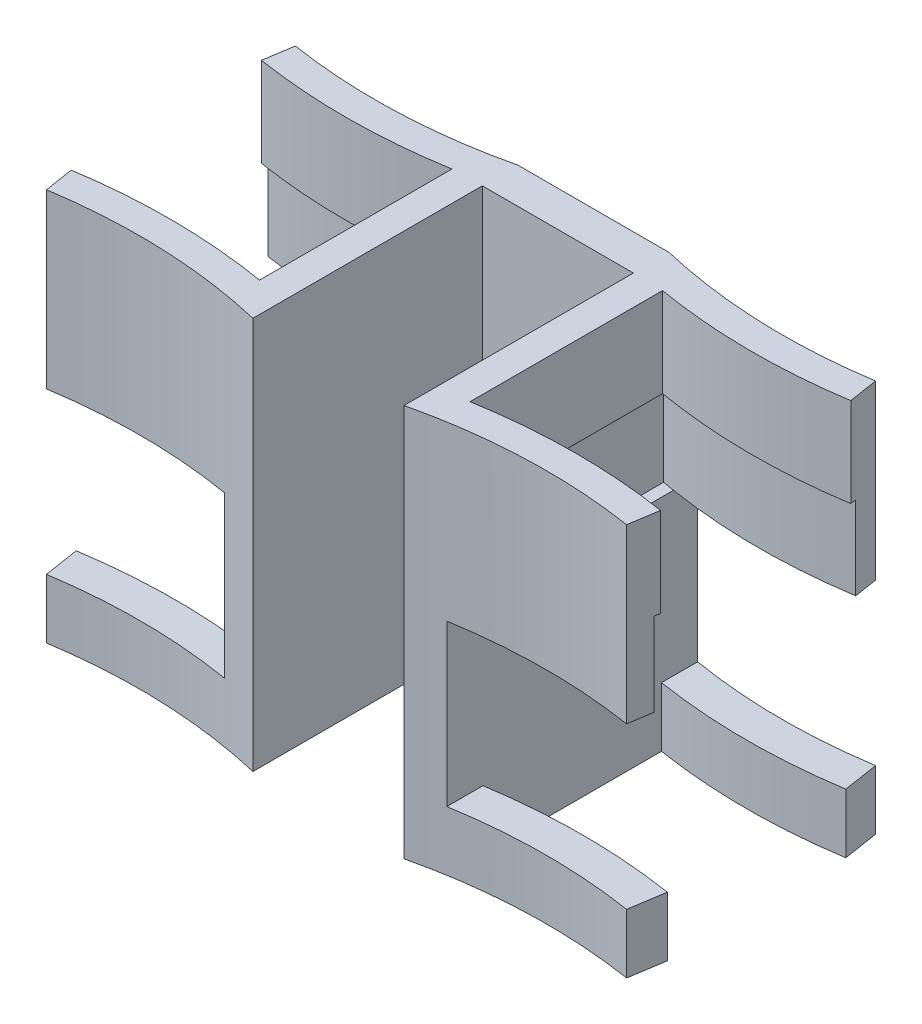
from build123d import *

# Parameters (mm, degrees)
BOSS_EXTRUDE1_DEPTH = 66
CUT_EXTRUDE1_START  = -15
CUT_EXTRUDE1_DEPTH  = 15
CUT_EXTRUDE2_START  = -14
CUT_EXTRUDE2_DEPTH  = 14
SKETCH4_W           = 44.566501288
SKETCH4_H           = 27
CUT_EXTRUDE3_DEPTH  = 103.576483765
SKETCH5_W           = 44.566501288
SKETCH5_H           = 27
CUT_EXTRUDE4_DEPTH  = 103.576483765


with BuildPart() as part:
    # Sketch1 → Boss-Extrude1 (new body)
    with BuildSketch(Plane(origin=(0, 0, 0), x_dir=(1, 0, 0), z_dir=(0, 1, 0))):
        with BuildLine():
            Line((-6, -1.283250644), (-6, -31.283250644))
            ThreePointArc((-6, -31.283250644), (-21.5, -30.074697642), (-37, -31.283250644))
            Line((-37, -31.283250644), (-36.07, -37.210737464))
            ThreePointArc((-36.07, -37.210737464), (-17.969313256, -36.14102822), (0, -38.566501288))
            Line((0, -38.566501288), (0, 0))
            Line((0, 0), (25.4, 0))
            Line((25.4, 0), (25.4, -38.566501288))
            ThreePointArc((25.4, -38.566501288), (43.369313256, -36.14102822), (61.47, -37.210737464))
            Line((61.47, -37.210737464), (62.4, -31.283250644))
            ThreePointArc((62.4, -31.283250644), (46.9, -30.074697642), (31.4, -31.283250644))
            Line((31.4, -31.283250644), (31.4, -1.283250644))
            ThreePointArc((31.4, -1.283250644), (46.9, -2.491803646), (62.4, -1.283250644))
            Line((62.4, -1.283250644), (61.47, 4.644236176))
            ThreePointArc((61.47, 4.644236176), (43.369313256, 3.574526932), (25.4, 6))
            Line((25.4, 6), (0, 6))
            ThreePointArc((0, 6), (-17.969313256, 3.574526932), (-36.07, 4.644236176))
            Line((-36.07, 4.644236176), (-37, -1.283250644))
            ThreePointArc((-37, -1.283250644), (-21.5, -2.491803646), (-6, -1.283250644))
        make_face()
    extrude(amount=BOSS_EXTRUDE1_DEPTH)

    # Sketch2 → Cut-Extrude1 (cut)
    # profile 1 of 2: a face of its own
    with BuildSketch(Plane(origin=(0, 66, 0), x_dir=(1, 0, 0), z_dir=(0, 1, 0)).offset(CUT_EXTRUDE1_START)):
        with BuildLine():
            Line((-5, -0.107120067), (-5, -32.459381221))
            ThreePointArc((-5, -32.459381221), (-21.5, -31.074697642), (-38, -32.459381221))
            Line((-38, -32.459381221), (-38, -0.107120067))
            ThreePointArc((-38, -0.107120067), (-21.5, -1.491803646), (-5, -0.107120067))
        make_face()
        with BuildLine():
            Line((-6, -1.283250644), (-6, -31.283250644))
            ThreePointArc((-6, -31.283250644), (-21.5, -30.074697642), (-37, -31.283250644))
            Line((-37, -31.283250644), (-37, -1.283250644))
            ThreePointArc((-37, -1.283250644), (-21.5, -2.491803646), (-6, -1.283250644))
        make_face(mode=Mode.SUBTRACT)
    # profile 2 of 2: a face of its own
    with BuildSketch(Plane(origin=(0, 66, 0), x_dir=(1, 0, 0), z_dir=(0, 1, 0)).offset(CUT_EXTRUDE1_START)):
        with BuildLine():
            Line((63.4, -0.107120067), (63.4, -32.459381221))
            ThreePointArc((63.4, -32.459381221), (46.9, -31.074697642), (30.4, -32.459381221))
            Line((30.4, -32.459381221), (30.4, -0.107120067))
            ThreePointArc((30.4, -0.107120067), (46.9, -1.491803646), (63.4, -0.107120067))
        make_face()
        with BuildLine():
            Line((31.4, -1.283250644), (31.4, -31.283250644))
            ThreePointArc((31.4, -31.283250644), (46.9, -30.074697642), (62.4, -31.283250644))
            Line((62.4, -31.283250644), (62.4, -1.283250644))
            ThreePointArc((62.4, -1.283250644), (46.9, -2.491803646), (31.4, -1.283250644))
        make_face(mode=Mode.SUBTRACT)
    extrude(amount=CUT_EXTRUDE1_DEPTH, mode=Mode.SUBTRACT)

    # Sketch3 → Cut-Extrude2 (cut)
    # profile 1 of 2: a face of its own
    with BuildSketch(Plane(origin=(0, 51, 0), x_dir=(1, 0, 0), z_dir=(0, 1, 0)).offset(CUT_EXTRUDE2_START)):
        with BuildLine():
            Line((-4, 1.083355157), (-4, -33.649856445))
            ThreePointArc((-4, -33.649856445), (-21.5, -32.074697642), (-39, -33.649856445))
            Line((-39, -33.649856445), (-39, 1.083355157))
            ThreePointArc((-39, 1.083355157), (-21.5, -0.491803646), (-4, 1.083355157))
        make_face()
        with BuildLine():
            Line((-37, -1.283250644), (-37, -31.283250644))
            ThreePointArc((-37, -31.283250644), (-21.5, -30.074697642), (-6, -31.283250644))
            Line((-6, -31.283250644), (-6, -1.283250644))
            ThreePointArc((-6, -1.283250644), (-21.5, -2.491803646), (-37, -1.283250644))
        make_face(mode=Mode.SUBTRACT)
    # profile 2 of 2: a face of its own
    with BuildSketch(Plane(origin=(0, 51, 0), x_dir=(1, 0, 0), z_dir=(0, 1, 0)).offset(CUT_EXTRUDE2_START)):
        with BuildLine():
            Line((64.4, 1.083355157), (64.4, -33.649856445))
            ThreePointArc((64.4, -33.649856445), (46.9, -32.074697642), (29.4, -33.649856445))
            Line((29.4, -33.649856445), (29.4, 1.083355157))
            ThreePointArc((29.4, 1.083355157), (46.9, -0.491803646), (64.4, 1.083355157))
        make_face()
        with BuildLine():
            Line((31.4, -1.283250644), (31.4, -31.283250644))
            ThreePointArc((31.4, -31.283250644), (46.9, -30.074697642), (62.4, -31.283250644))
            Line((62.4, -31.283250644), (62.4, -1.283250644))
            ThreePointArc((62.4, -1.283250644), (46.9, -2.491803646), (31.4, -1.283250644))
        make_face(mode=Mode.SUBTRACT)
    extrude(amount=CUT_EXTRUDE2_DEPTH, mode=Mode.SUBTRACT)

    # Sketch4 → Cut-Extrude3 (cut, through all)
    with BuildSketch(Plane.ZY.offset(6)):
        with Locations((16.283250644, 23.5)):
            Rectangle(SKETCH4_W, SKETCH4_H)
    extrude(amount=CUT_EXTRUDE3_DEPTH, mode=Mode.SUBTRACT)

    # Sketch5 → Cut-Extrude4 (cut, through all)
    with BuildSketch(Plane(origin=(31.4, 0, 0), x_dir=(0, 0, -1), z_dir=(1, 0, 0))):
        with Locations((-16.283250644, 23.5)):
            Rectangle(SKETCH5_W, SKETCH5_H)
    extrude(amount=CUT_EXTRUDE4_DEPTH, mode=Mode.SUBTRACT)


solid = part.part
